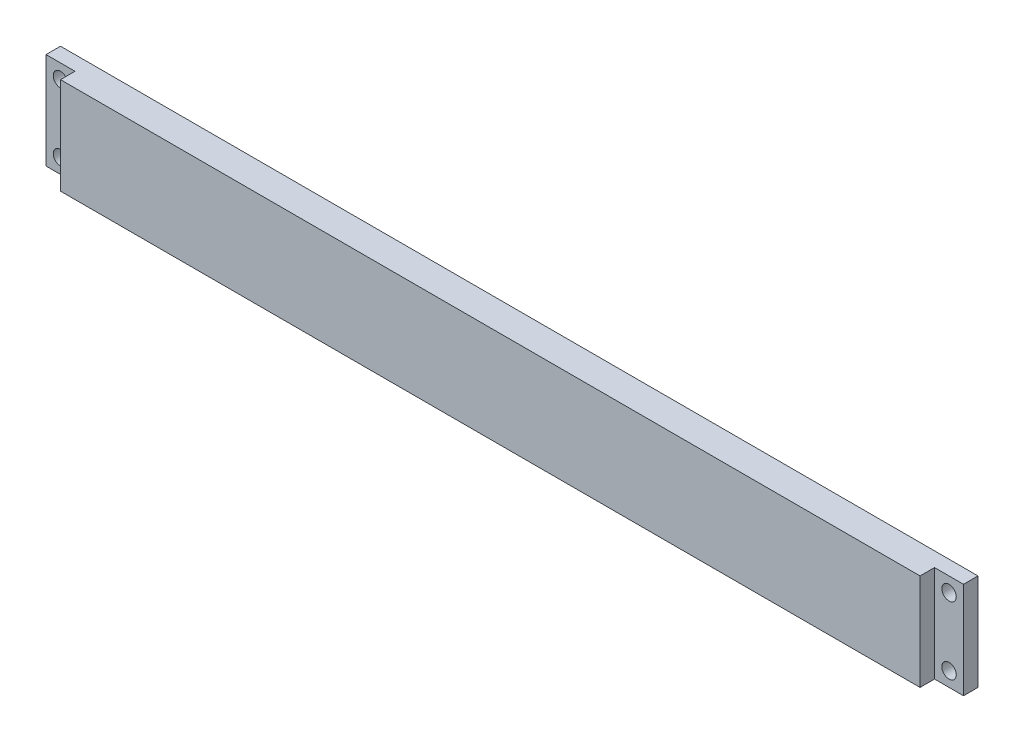
from build123d import *

# Parameters (mm, degrees)
ESQUISSE1_W             = 190
ESQUISSE1_H             = 20
BOSS_EXTRU_1_DEPTH      = 6
ESQUISSE2_W             = 6
ESQUISSE2_H             = 20
ENL_V_MAT_EXTRU_1_DEPTH = 3
ESQUISSE3_R             = 1.5
ENL_V_MAT_EXTRU_2_DEPTH = 6


with BuildPart() as part:
    # Esquisse1 → Boss.-Extru.1 (new body)
    with BuildSketch(Plane.XY):
        Rectangle(ESQUISSE1_W, ESQUISSE1_H)
    extrude(amount=BOSS_EXTRU_1_DEPTH)

    # Esquisse2 → Enlèv. mat.-Extru.1 (cut)
    with BuildSketch(Plane.XY.offset(6)):
        with Locations((-92, 0)):
            Rectangle(ESQUISSE2_W, ESQUISSE2_H)
        with Locations((92, 0)):
            Rectangle(ESQUISSE2_W, ESQUISSE2_H)
    extrude(amount=-ENL_V_MAT_EXTRU_1_DEPTH, mode=Mode.SUBTRACT)

    # Esquisse3 → Enlèv. mat.-Extru.2 (cut)
    with BuildSketch(Plane(origin=(0, 0, 0), x_dir=(-1, 0, 0), z_dir=(0, 0, -1))):
        with Locations((-92, -7)):
            Circle(ESQUISSE3_R)
        with Locations((-92, 7)):
            Circle(ESQUISSE3_R)
        with Locations((92, 7)):
            Circle(ESQUISSE3_R)
        with Locations((92, -7)):
            Circle(ESQUISSE3_R)
    extrude(amount=-ENL_V_MAT_EXTRU_2_DEPTH, mode=Mode.SUBTRACT)


solid = part.part
